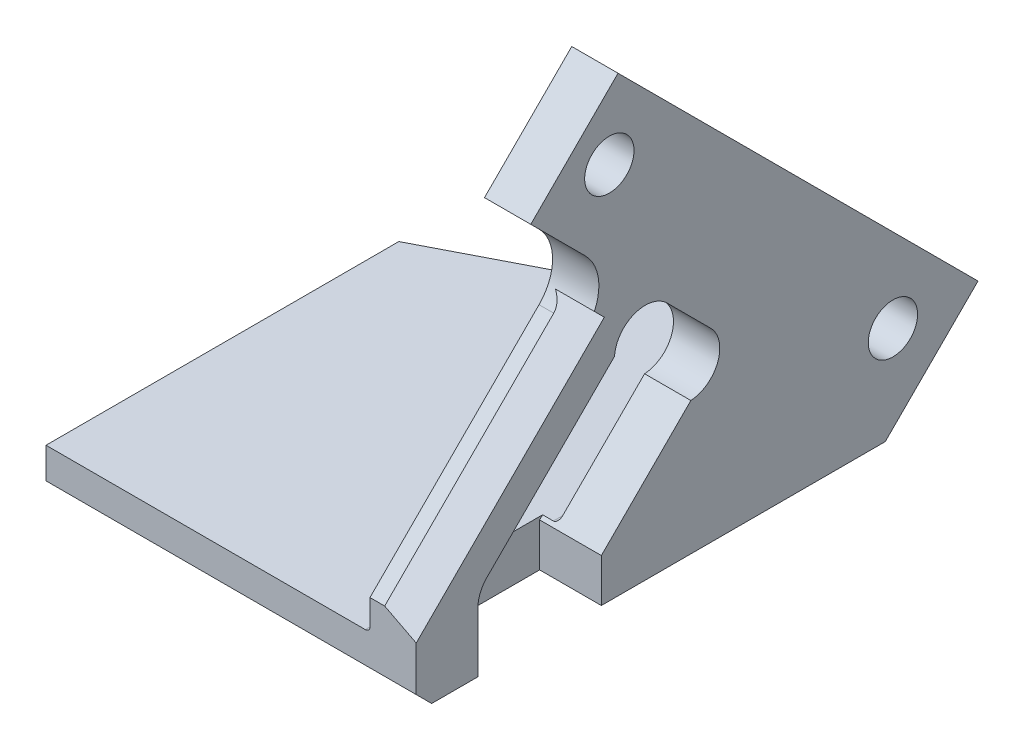
from build123d import *

# Parameters (mm, degrees)
EXTRUDE_1_DEPTH     = 40
CUT_EXTRUDE_START   = -3
CUT_EXTRUDE_1_DEPTH = 24
CUT_EXTRUDE_2_DEPTH = 53.224395281
CUT_EXTRUDE_3_DEPTH = 4
CUT_EXTRUDE_START_2 = 2
CUT_EXTRUDE_6_DEPTH = 50.413883947
CHAMFER_1_SIZE      = 1
FILLET_1_R          = 0.3


# Read off the part's stored shape, not the designer's step: Вырез-Вытянуть1, Отверстие с зазором M31
with BuildPart() as part:
    # Эскиз1 → Бобышка-Вытянуть1 (new body)
    with BuildSketch(Plane.XY):
        Polygon((0, 0), (0, 35), (3, 35), (3, -3), (-21, -3), (-21, 0), align=None)
    extrude(amount=EXTRUDE_1_DEPTH)

    # Вырез-Вытянуть1 outline → Вырез-Вытянуть1 (cut)
    with BuildSketch(Plane.ZY.offset(CUT_EXTRUDE_START)):
        with BuildLine():
            ThreePointArc((29.039844892, 17.152543264), (28.161165235, 15.03122292), (29.039844892, 12.909902577))
            Line((29.039844892, 12.909902577), (40, 1.949747468))
            Line((40, 1.949747468), (40, 35))
            Line((40, 35), (0, 35))
            Line((0, 35), (0, -3))
            Line((0, -3), (9.594408409, -3))
            Line((9.594408409, -3), (3.584000769, 3.01040764))
            Line((3.584000769, 3.01040764), (26.918524548, 26.344931419))
            Line((26.918524548, 26.344931419), (32.575378798, 20.68807717))
            Line((32.575378798, 20.68807717), (29.039844892, 17.152543264))
        make_face()
    extrude(amount=CUT_EXTRUDE_1_DEPTH, mode=Mode.SUBTRACT)

    # Эскиз3 → Вырез-Вытянуть2 (cut, through all)
    with BuildSketch(Plane(origin=(0, -0.286796564, 0.286796564), x_dir=(1, 0, 0), z_dir=(0, 0.7071067811865488, -0.7071067811865462))):
        Polygon((-118.62691727, -47.645487261), (-21, -12.112195311), (-0.533369199, -4.662950904), (97.093548071, 30.870341046), (26.026964172, 226.124175586), (-189.693501169, 147.608347279), align=None)
    extrude(amount=-CUT_EXTRUDE_2_DEPTH, mode=Mode.SUBTRACT)

    # Эскиз4 → Вырез-Вытянуть3 (cut)
    with BuildSketch(Plane(origin=(3, 0, 0), x_dir=(0, 0, -1), z_dir=(1, 0, 0))):
        with BuildLine():
            Line((-28, -3), (-28, -0.192388155))
            Line((-28, -0.192388155), (-22.197084645, 5.610527199))
            ThreePointArc((-22.197084645, 5.610527199), (-20.451501777, 6.899494937), (-20.908116908, 9.02081528))
            Line((-20.908116908, 9.02081528), (-23.736544033, 11.849242405))
            ThreePointArc((-23.736544033, 11.849242405), (-25.857864376, 12.305857536), (-27.146832114, 10.560274668))
            Line((-27.146832114, 10.560274668), (-35.414213562, 2.292893219))
            ThreePointArc((-35.414213562, 2.292893219), (-35.847759065, 1.644046521), (-36, 0.878679656))
            Line((-36, 0.878679656), (-36, -3))
            Line((-36, -3), (-28, -3))
        make_face()
    extrude(amount=-CUT_EXTRUDE_3_DEPTH, mode=Mode.SUBTRACT)

    # Эскиз5 → Вырез-Вытянуть6 (cut, through all)
    with BuildSketch(Plane(origin=(0, -5.943650814, 5.943650814), x_dir=(1, 0, 0), z_dir=(0, -0.7071067811865488, 0.7071067811865464)).offset(CUT_EXTRUDE_START_2)):
        Polygon((0, 30.009937166), (3, 28.918026463), (3, 37.662950904), (0, 37.662950904), align=None)
    extrude(amount=CUT_EXTRUDE_6_DEPTH, mode=Mode.SUBTRACT)

    # Фаска1
    chamfer_1_edges = [part.edges().sort_by_distance(p)[0] for p in [
        (-9, -3, 40),
    ]]
    chamfer(chamfer_1_edges, length=CHAMFER_1_SIZE)

    # Отверстие с зазором M31 outline → Отверстие с зазором M31 (revolve, cut)
    with BuildSketch(Plane(origin=(0, 3.108402615, 9.098433688), x_dir=(0, 1, 0), z_dir=(0, 0, -1))):
        Polygon((0, 0), (1.725, 0), (1.6, 0.125), (1.6, 3), (0, 3), align=None)
    revolve(axis=Axis((0, 3.108402615, 9.098433688), (1, 0, 0)), mode=Mode.SUBTRACT)

    # Hole Wizard M31 2 outline → Hole Wizard M31 2 (revolve, cut)
    with BuildSketch(Plane(origin=(0, 21.493178926, 27.483209999), x_dir=(0, 1, 0), z_dir=(0, 0, -1))):
        Polygon((0, 0), (1.725, 0), (1.6, 0.125), (1.6, 3), (0, 3), align=None)
    revolve(axis=Axis((0, 21.493178926, 27.483209999), (1, 0, 0)), mode=Mode.SUBTRACT)

    # Скругление1
    fillet_1_edges = [part.edges().sort_by_distance(p)[0] for p in [
        (0, 0, 38),
        (0, 0, 17.201010127),
    ]]
    fillet(fillet_1_edges, radius=FILLET_1_R)


solid = part.part
